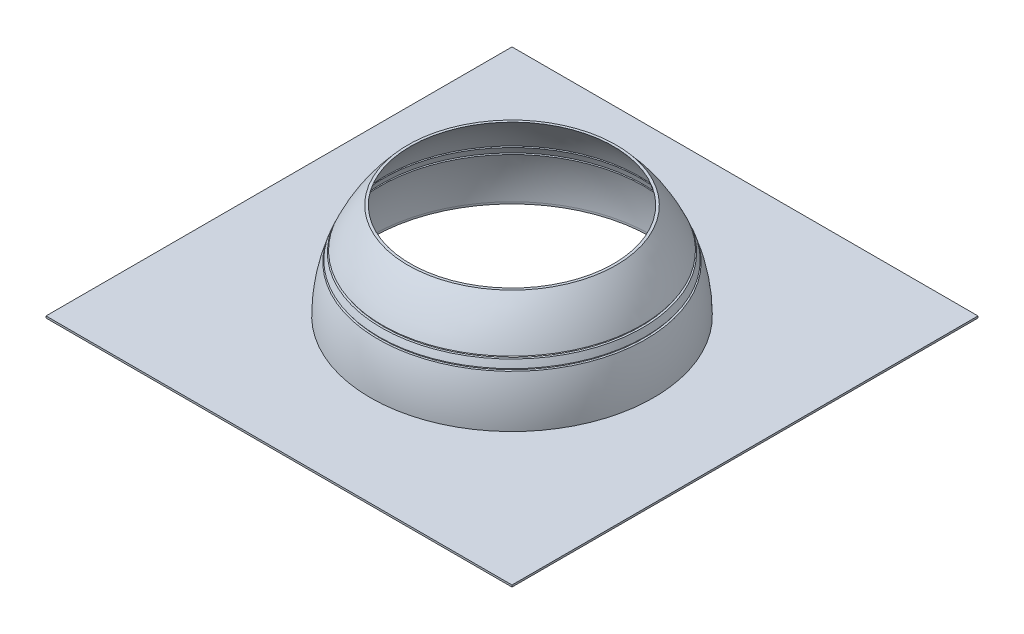
from build123d import *

# Parameters (mm, degrees)
SKETCH1_W               = 500
SKETCH1_H               = 500
BASE_FLANGE1_DEPTH      = 2
CUT_EXTRUDE1_DEPTH      = 385.84282506
CUT_EXTRUDE1_DEPTH_BACK = 385.84282506
SKETCH8_W               = 401.481262669
SKETCH8_H               = 2
SKETCH8_W_2             = 494.130784823
CUT_EXTRUDE2_DEPTH      = 386.637135141
CUT_EXTRUDE2_DEPTH_BACK = 2
SKETCH15_R              = 150
CUT_EXTRUDE3_DEPTH      = 385.84282506
CUT_EXTRUDE3_DEPTH_BACK = 385.84282506
SKETCH16_W              = 352.950560588
SKETCH16_H              = 50
SKETCH17_W              = 15
SKETCH17_H              = 4
CUT_EXTRUDE5_DEPTH      = 150


# Sheet-metal steps are written as plain solids
with BuildPart() as part:
    # Sketch1 → Base-Flange1 (new body)
    with BuildSketch(Plane(origin=(0, 0, 0), x_dir=(1, 0, 0), z_dir=(0, 1, 0))):
        Rectangle(SKETCH1_W, SKETCH1_H)
    extrude(amount=-BASE_FLANGE1_DEPTH)

    # Sketch7 → Revolve1 (revolve)
    with BuildSketch(Plane.XY, mode=Mode.PRIVATE) as revolve1_sk:
        with BuildLine():
            Line((0, 152), (0, 150))
            ThreePointArc((0, 150), (-106.066017178, 106.066017178), (-150, 0))
            Line((-150, 0), (-152, 0))
            ThreePointArc((-152, 0), (-107.48023074, 107.48023074), (0, 152))
        make_face()
    revolve(revolve1_sk.sketch.rotate(Axis((0, 194.50152145, 0), (0, -1, 0)), 180), axis=Axis((0, 194.50152145, 0), (0, -1, 0)))

    # Sketch8 → Cut-Extrude1 (cut, two sides: drawn at the far end of the back side and taken through both)
    with BuildSketch(Plane.XY.offset(-CUT_EXTRUDE1_DEPTH_BACK)):
        with Locations((-16.544557528, 60)):
            Rectangle(SKETCH8_W, SKETCH8_H)
        with Locations((18.750498531, 51)):
            Rectangle(SKETCH8_W_2, SKETCH8_H)
    extrude(amount=CUT_EXTRUDE1_DEPTH + CUT_EXTRUDE1_DEPTH_BACK, mode=Mode.SUBTRACT)


with BuildPart() as cut_extrude1_piece_1:
    # of the separate pieces the step leaves, piece 1, a body of its own (cut_extrude1_pieces)
    add(part.part.solids().sort_by_distance((-250, 0, -250))[0])

    # Sketch15 → Cut-Extrude2 (cut, two sides: drawn at the far end of the back side and taken through both)
    with BuildSketch(Plane.XZ.offset(2).offset(-CUT_EXTRUDE2_DEPTH_BACK)):
        with Locations(Location((0, 0, 0), (0, 0, 90))):
            Circle(SKETCH15_R)
    extrude(amount=CUT_EXTRUDE2_DEPTH + CUT_EXTRUDE2_DEPTH_BACK, mode=Mode.SUBTRACT)


with BuildPart() as cut_extrude1_piece_2:
    # of the separate pieces the step leaves, piece 2, a body of its own (cut_extrude1_pieces)
    add(part.part.solids().sort_by_distance((139.222842953, 61, 0))[0])

    # Sketch16 → Cut-Extrude3 (cut, two sides: drawn at the far end of the back side and taken through both)
    with BuildSketch(Plane.XY.offset(-CUT_EXTRUDE3_DEPTH_BACK)):
        with Locations((-5.514852509, 128)):
            Rectangle(SKETCH16_W, SKETCH16_H)
    extrude(amount=CUT_EXTRUDE3_DEPTH + CUT_EXTRUDE3_DEPTH_BACK, mode=Mode.SUBTRACT)


with BuildPart() as cut_extrude1_piece_3:
    # of the separate pieces the step leaves, piece 3, a body of its own (cut_extrude1_pieces)
    add(part.part.solids().sort_by_distance((142.828568571, 52, 0))[0])

    # Sketch17 → Cut-Extrude5 (cut)
    with BuildSketch(Plane.XY):
        with Locations((18.811352245, 55.5)):
            Rectangle(SKETCH17_W, SKETCH17_H)
    extrude(amount=-CUT_EXTRUDE5_DEPTH, mode=Mode.SUBTRACT)


solid = Compound([cut_extrude1_piece_1.part, cut_extrude1_piece_2.part, cut_extrude1_piece_3.part])
